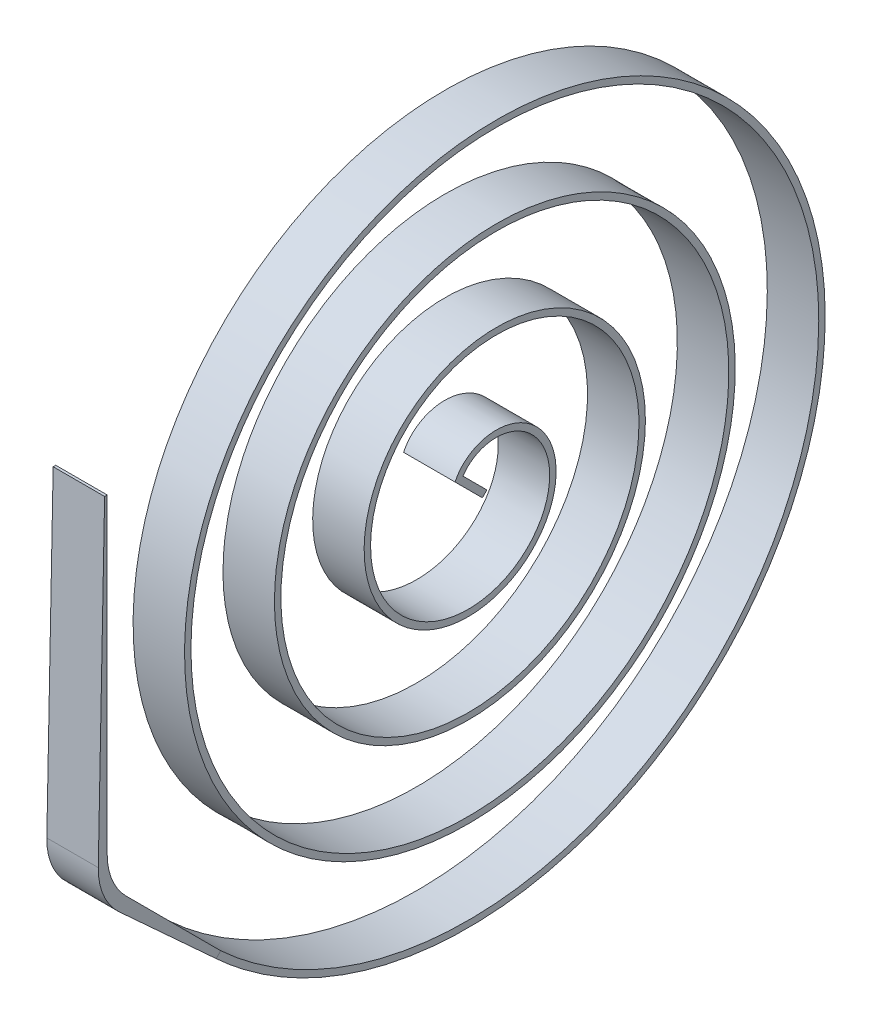
from build123d import *

# Parameters (mm, degrees)
EXTRUDE_1_DEPTH     = 4
CUT_EXTRUDE_3_DEPTH = 4
EXTRUDE_2_DEPTH     = 4
EXTRUDE_3_DEPTH     = 4
FILLET_1_R          = 5


# Read off the part's stored shape, not the designer's step: 拉伸-薄壁1
with BuildPart() as part:
    # 拉伸-薄壁1 outline → 拉伸-薄壁1 (new body)
    with BuildSketch(Plane(origin=(0, 0, 0), x_dir=(0, 0, -1), z_dir=(1, 0, 0))):
        with BuildLine():
            Line((0.353553391, 0.353553391), (-1.503648468, 2.210755249))
            add(Edge.make_bspline(
                [(-1.503648468, 2.210755249), (-1.308098184, 2.515457282), (-1.031402176, 2.800209118), (-0.328960064, 3.251074047), (0.093348021, 3.416104406), (1.028521806, 3.556280116), (1.537893991, 3.531997306), (2.557201106, 3.252783079), (3.064291, 2.999904179), (3.973331649, 2.265948866), (4.3736449, 1.78796665), (4.968150132, 0.654331864), (5.162234178, 0.002190375), (5.269337908, -1.385645211), (5.183809562, -2.118110209), (4.700879937, -3.542487003), (4.306223926, -4.232098419), (3.229498206, -5.437416781), (2.550950629, -5.952227855), (0.987695292, -6.689789787), (0.10661298, -6.913264176), (-1.732750598, -6.988989256), (-2.688010948, -6.843492742), (-4.517860059, -6.159766195), (-5.390643168, -5.624933843), (-6.894524558, -4.20837832), (-7.525429726, -3.330584156), (-8.409947858, -1.339602577), (-8.665084385, -0.230141492), (-8.714241785, 2.060643361), (-8.511286323, 3.239164327), (-7.631553511, 5.476475434), (-6.958793489, 6.533959404), (-5.206225045, 8.340344427), (-4.130716409, 9.089750306), (-1.714062255, 10.126570298), (-0.376708147, 10.416289415), (2.365690797, 10.444798439), (3.768179747, 10.187348934), (6.415486985, 9.117140593), (7.659512606, 8.308971908), (9.77296892, 6.224609053), (10.643595166, 4.95303249), (11.838660304, 2.112884571), (12.166154256, 0.548120606), (12.180434414, -2.646162399), (11.871664619, -4.273406452), (10.616881722, -7.333450331), (9.675963351, -8.765979862), (7.264258556, -11.191346802), (5.798336458, -12.186048016), (2.536982574, -13.545587787), (0.74531457, -13.914177117), (-2.901116915, -13.920912023), (-4.753920264, -13.564104867), (-8.229513185, -12.130867005), (-9.852552284, -11.0599419), (-12.59479217, -8.325508549), (-13.715955477, -6.666709919), (-15.24808083, -2.987011929), (-15.659320782, -0.968747991), (-15.667155005, 3.13031639), (-15.263864334, 5.208942783), (-14.060973281, 8.130146392), (-13.561650638, 9.070939818), (-12.37974169, 10.848237384), (-11.697591423, 11.684641224), (-10.171912436, 13.217474321), (-9.328834721, 13.913901754), (-7.510138999, 15.135705335), (-6.534964906, 15.661179757), (-4.48689411, 16.515963213), (-3.414412198, 16.845467335), (-1.211286336, 17.290306612), (-0.081007129, 17.405925566), (2.194866022, 17.412992271), (3.340164037, 17.304799944), (5.601562911, 16.862835185), (6.717452311, 16.529482273), (8.875584174, 15.644643338), (9.917711376, 15.093616737), (11.885695488, 13.789648494), (12.811540497, 13.037184233), (14.507895282, 11.354893285), (15.278498703, 10.425538795), (16.630493359, 8.421576024), (17.212080811, 7.34741154), (18.158814241, 5.092396621), (18.52425095, 3.911939433), (19.019329016, 1.487988009), (19.149342807, 0.244816501), (19.163038333, -2.257444027), (19.047157211, -3.516297612), (18.567955532, -6.001115467), (18.205116422, -7.226944309), (17.240571879, -9.597107328), (16.639369357, -10.741414054), (15.216224255, -12.902050072), (14.394781864, -13.918462659), (12.558327882, -15.780827824), (11.543789407, -16.626971806), (9.356481346, -18.112075882), (8.184134493, -18.751327512), (5.723496288, -19.793248764), (4.435556178, -20.196297069), (1.791448098, -20.745048835), (0.435542051, -20.891200712), (-2.293115181, -20.91502694), (-3.665707384, -20.793198414), (-6.374632348, -20.280195855), (-7.710917765, -19.889544016), (-10.294453646, -18.848533597), (-11.541771691, -18.198697179), (-13.897004826, -16.659295467), (-15.005100069, -15.770226975), (-17.035951273, -13.782099539), (-17.958992028, -12.683487742), (-19.580118348, -10.314798343), (-20.278580181, -9.045096197), (-21.418929266, -6.380197921), (-21.861266459, -4.985286908), (-22.467136598, -2.121732261), (-22.631171578, -0.653269114), (-22.668647421, 2.301755507), (-22.542618103, 3.788250303), (-21.999274449, 6.721935674), (-21.58249188, 8.16917693), (-20.468284973, 10.967397527), (-19.771368281, 12.318542601), (-18.118664785, 14.870294189), (-17.163336528, 16.071173393), (-15.026063548, 18.272969208), (-13.844505672, 19.274251944), (-11.296439664, 21.034303624), (-9.930227629, 21.793513832), (-7.062474325, 23.035528763), (-5.56112391, 23.518827715), (-2.47887423, 24.185266692), (-0.898051423, 24.368928974), (2.283271655, 24.423586735), (3.883813153, 24.295106072), (7.042875828, 23.724901631), (8.60155313, 23.283676758), (11.615738385, 22.099569702), (13.071508594, 21.357136182), (15.821673677, 19.594118159), (17.116422603, 18.573909389), (19.491601863, 16.290055549), (20.572458854, 15.026694424), (22.474326535, 12.301296354), (23.295813419, 10.839437575), (24.642727453, 7.770275734), (25.168654592, 6.163036725), (25.899116013, 2.862885134), (26.104147024, 1.169920324), (26.179529941, -2.237592036), (26.050348406, -3.952303921), (25.456781832, -7.337323347), (24.992807885, -9.00789697), (23.742122123, -12.239293529), (22.955743664, -13.800468242), (21.085429334, -16.750913934), (20.001731113, -18.140601461), (17.573896798, -20.69158146), (16.229890037, -21.853330555), (13.329243599, -23.899890516), (11.772618481, -24.785170938), (8.503535756, -26.240210682), (6.790978099, -26.810424401), (3.273759401, -27.608363185), (1.468890595, -27.836500028), (-2.164661204, -27.936160578), (-3.993646307, -27.808028204), (-7.605163775, -27.194614983), (-9.388073378, -26.709588679), (-12.837893648, -25.395669467), (-14.505232591, -24.566925269), (-17.657796947, -22.592362779), (-19.143473991, -21.446577062), (-21.872649226, -18.877397596), (-23.116592644, -17.453916924), (-25.310705479, -14.380144472), (-26.261283574, -12.729650258), (-27.827667652, -9.26217526), (-28.443816994, -7.444887878), (-29.312688083, -3.711478607), (-29.565662243, -1.794964262), (-29.693160936, 2.064436179), (-29.567826088, 4.007776138), (-28.938097461, 7.846294285), (-28.433717884, 9.741958355), (-27.059933373, 13.41137983), (-26.190408974, 15.185622338), (-24.11467565, 18.542113552), (-22.908216099, 20.124810442), (-21.554287042, 21.579682802)],
                knots=[0, 0, 0, 0, 0.015625, 0.015625, 0.03125, 0.03125, 0.046875, 0.046875, 0.0625, 0.0625, 0.078125, 0.078125, 0.09375, 0.09375, 0.109375, 0.109375, 0.125, 0.125, 0.140625, 0.140625, 0.15625, 0.15625, 0.171875, 0.171875, 0.1875, 0.1875, 0.203125, 0.203125, 0.21875, 0.21875, 0.234375, 0.234375, 0.25, 0.25, 0.265625, 0.265625, 0.28125, 0.28125, 0.296875, 0.296875, 0.3125, 0.3125, 0.328125, 0.328125, 0.34375, 0.34375, 0.359375, 0.359375, 0.375, 0.375, 0.390625, 0.390625, 0.40625, 0.40625, 0.421875, 0.421875, 0.4375, 0.4375, 0.453125, 0.453125, 0.46875, 0.46875, 0.484375, 0.484375, 0.4921875, 0.4921875, 0.5, 0.5, 0.5078125, 0.5078125, 0.515625, 0.515625, 0.5234375, 0.5234375, 0.53125, 0.53125, 0.5390625, 0.5390625, 0.546875, 0.546875, 0.5546875, 0.5546875, 0.5625, 0.5625, 0.5703125, 0.5703125, 0.578125, 0.578125, 0.5859375, 0.5859375, 0.59375, 0.59375, 0.6015625, 0.6015625, 0.609375, 0.609375, 0.6171875, 0.6171875, 0.625, 0.625, 0.6328125, 0.6328125, 0.640625, 0.640625, 0.6484375, 0.6484375, 0.65625, 0.65625, 0.6640625, 0.6640625, 0.671875, 0.671875, 0.6796875, 0.6796875, 0.6875, 0.6875, 0.6953125, 0.6953125, 0.703125, 0.703125, 0.7109375, 0.7109375, 0.71875, 0.71875, 0.7265625, 0.7265625, 0.734375, 0.734375, 0.7421875, 0.7421875, 0.75, 0.75, 0.7578125, 0.7578125, 0.765625, 0.765625, 0.7734375, 0.7734375, 0.78125, 0.78125, 0.7890625, 0.7890625, 0.796875, 0.796875, 0.8046875, 0.8046875, 0.8125, 0.8125, 0.8203125, 0.8203125, 0.828125, 0.828125, 0.8359375, 0.8359375, 0.84375, 0.84375, 0.8515625, 0.8515625, 0.859375, 0.859375, 0.8671875, 0.8671875, 0.875, 0.875, 0.8828125, 0.8828125, 0.890625, 0.890625, 0.8984375, 0.8984375, 0.90625, 0.90625, 0.9140625, 0.9140625, 0.921875, 0.921875, 0.9296875, 0.9296875, 0.9375, 0.9375, 0.9453125, 0.9453125, 0.953125, 0.953125, 0.9609375, 0.9609375, 0.96875, 0.96875, 0.9765625, 0.9765625, 0.984375, 0.984375, 0.9921875, 0.9921875, 1, 1, 1, 1], degree=3))
            Line((-21.554287042, 21.579682802), (-21.920310217, 21.920310217))
            add(Edge.make_bspline(
                [(-2.121320344, 2.121320344), (-1.946759899, 2.502120266), (-1.675382244, 2.868908278), (-0.955566353, 3.482763508), (-0.507236314, 3.729166667), (0.507236314, 4.020833333), (1.072979751, 4.065524736), (2.227664853, 3.902936232), (2.815977181, 3.695297762), (3.90153724, 3.022216659), (4.398034458, 2.55671546), (5.187215692, 1.413625151), (5.479166667, 0.736310778), (5.770833333, -0.736310778), (5.76997692, -1.531038548), (5.432062411, -3.108998069), (5.094714737, -3.891433941), (4.097673419, -5.300954215), (3.438048676, -5.927160637), (1.871683948, -6.891667876), (0.965385243, -7.229166667), (-0.965385243, -7.520833333), (-1.989097346, -7.474429105), (-3.990331285, -6.961188591), (-4.966890701, -6.494131711), (-6.700371189, -5.173130179), (-7.456286817, -4.319381891), (-8.59612006, -2.329742746), (-8.979166667, -1.194459707), (-9.270833333, 1.194459707), (-9.178881289, 2.447156144), (-8.49031477, 4.8716645), (-7.893548685, 6.042347461), (-6.248586939, 8.099788163), (-5.200715107, 8.985412997), (-2.787801544, 10.300572245), (-1.423534171, 10.729166667), (1.423534171, 11.020833333), (2.905214941, 10.883333473), (5.752997716, 10.01944095), (7.117804221, 9.292965659), (9.499205137, 7.324043699), (10.514539176, 6.082048323), (12.005024429, 3.245860341), (12.479166667, 1.652608635), (12.770833333, -1.652608635), (12.587785657, -3.363273739), (11.54856713, -6.634330932), (10.692382633, -8.193260981), (8.399500459, -10.898622111), (6.963381538, -12.043665356), (3.703919139, -13.709476613), (1.8816831, -14.229166667), (-1.8816831, -14.520833333), (-3.821332537, -14.292237841), (-7.515664147, -13.077693309), (-9.268717741, -12.091799608), (-12.298039085, -9.474957219), (-13.572791535, -7.844714754), (-14.953644482, -5.082662141), (-15.325999225, -4.109988019), (-15.875232508, -2.09632285), (-16.052083333, -1.055378782), (-16.197916667, 1.055378782), (-16.166881158, 2.125140086), (-15.892537695, 4.251874815), (-15.649222391, 5.308792841), (-14.954287123, 7.367595856), (-14.502671029, 8.369424421), (-13.403527834, 10.276901525), (-12.756015931, 11.18249489), (-11.285614629, 12.85913567), (-10.4627514, 13.630131435), (-8.6696985, 15.003603338), (-7.699545161, 15.606033532), (-5.646539543, 16.614265165), (-4.563732514, 17.02002836), (-2.325394482, 17.613951854), (-1.169916014, 17.802083333), (1.169916014, 17.947916667), (2.354211718, 17.905600504), (4.70561931, 17.586566831), (5.872670243, 17.309843074), (8.143110467, 16.527244804), (9.246438101, 16.021376327), (11.34438366, 14.794966179), (12.338941704, 14.074442852), (14.177562591, 12.442061443), (15.02156978, 11.530233535), (16.522308637, 9.54671218), (17.178991212, 8.475059772), (18.274885848, 6.210416945), (18.714057495, 5.017477009), (19.3526712, 2.554466114), (19.552083333, 1.284453246), (19.697916667, -1.284453246), (19.64431985, -2.58328335), (19.280595966, -5.159363805), (18.970463757, -6.436547646), (18.100202485, -8.918625078), (17.540081625, -10.123451781), (16.186404524, -12.411865796), (15.392869772, -13.495388517), (13.598508256, -15.495989511), (12.597715671, -16.413008125), (10.42372586, -18.041013935), (9.250574383, -18.751948893), (6.774294347, -19.935506531), (5.471221504, -20.40808663), (2.783537746, -21.091390547), (1.398990479, -21.302083333), (-1.398990479, -21.447916667), (-2.812354982, -21.383039196), (-5.6131083, -20.974625101), (-7.000425048, -20.63108444), (-9.694139689, -19.673160165), (-11.00046546, -19.058786923), (-13.479347932, -17.577842869), (-14.651835331, -16.711296693), (-16.814416432, -14.75495507), (-17.80444647, -13.665197807), (-19.559719233, -11.300739539), (-20.324906574, -10.026088994), (-21.596127214, -7.338171749), (-22.102115766, -5.924965999), (-22.830109893, -3.012609378), (-23.052083333, -1.513527711), (-23.197916667, 1.513527711), (-23.121758543, 3.041426615), (-22.668654236, 6.066852795), (-22.291705123, 7.56430245), (-21.246117846, 10.4696543), (-20.577492222, 11.87747914), (-18.969281213, 14.546830068), (-18.029723614, 15.808282144), (-15.911401883, 18.132843352), (-14.732679943, 19.195884814), (-12.177753219, 21.078424531), (-10.801603605, 21.897864255), (-7.902049152, 23.256747897), (-6.378710494, 23.796144901), (-3.241681011, 24.568829239), (-1.628064943, 24.802083333), (1.628064943, 24.947916667), (3.270498247, 24.860477889), (6.52059729, 24.362683371), (8.128179852, 23.952325807), (11.245168911, 22.819075527), (12.75449282, 22.09619752), (15.614312204, 20.360719558), (16.964728958, 19.348150534), (19.451270273, 17.067848697), (20.587323159, 15.800162079), (22.59712983, 13.054766899), (23.470821935, 11.577118216), (24.91736858, 8.465926554), (25.490174036, 6.832454989), (26.307548585, 3.470752643), (26.552083333, 1.742602175), (26.697916667, -1.742602175), (26.599197235, -3.499569879), (26.056712507, -6.974341784), (25.61294649, -8.692057254), (24.392033208, -12.020683523), (23.614902818, -13.6315065), (21.752157903, -16.681794339), (20.666577455, -18.121175772), (18.22429551, -20.769697194), (16.867644214, -21.978761504), (13.931780579, -24.115835128), (12.352632828, -25.043779616), (9.029803956, -26.577989263), (7.286199484, -27.184203171), (3.699824275, -28.046267932), (1.857139407, -28.302083333), (-1.857139407, -28.447916667), (-3.728641511, -28.337916581), (-7.428086279, -27.750741642), (-9.255934656, -27.273567173), (-12.796198134, -25.964990888), (-14.508520179, -25.133608117), (-17.749276475, -23.143596248), (-19.277622585, -21.985004375), (-22.088124114, -19.380742324), (-23.370199849, -17.93512635), (-25.634540426, -14.808794258), (-26.616737297, -13.128147439), (-28.238609946, -9.593681358), (-28.878232306, -7.739943978), (-29.784987278, -3.928895907), (-30.052083333, -1.971676639), (-30.197916667, 1.971676639), (-30.076635928, 3.957713143), (-29.444770777, 7.881830774), (-28.934187856, 9.819812058), (-27.537948569, 13.571712745), (-26.652313415, 15.385533859), (-24.535034592, 18.816758611), (-23.303431296, 20.434069399), (-21.920310217, 21.920310217)],
                knots=[0, 0, 0, 0, 0.015625, 0.015625, 0.03125, 0.03125, 0.046875, 0.046875, 0.0625, 0.0625, 0.078125, 0.078125, 0.09375, 0.09375, 0.109375, 0.109375, 0.125, 0.125, 0.140625, 0.140625, 0.15625, 0.15625, 0.171875, 0.171875, 0.1875, 0.1875, 0.203125, 0.203125, 0.21875, 0.21875, 0.234375, 0.234375, 0.25, 0.25, 0.265625, 0.265625, 0.28125, 0.28125, 0.296875, 0.296875, 0.3125, 0.3125, 0.328125, 0.328125, 0.34375, 0.34375, 0.359375, 0.359375, 0.375, 0.375, 0.390625, 0.390625, 0.40625, 0.40625, 0.421875, 0.421875, 0.4375, 0.4375, 0.453125, 0.453125, 0.4609375, 0.4609375, 0.46875, 0.46875, 0.4765625, 0.4765625, 0.484375, 0.484375, 0.4921875, 0.4921875, 0.5, 0.5, 0.5078125, 0.5078125, 0.515625, 0.515625, 0.5234375, 0.5234375, 0.53125, 0.53125, 0.5390625, 0.5390625, 0.546875, 0.546875, 0.5546875, 0.5546875, 0.5625, 0.5625, 0.5703125, 0.5703125, 0.578125, 0.578125, 0.5859375, 0.5859375, 0.59375, 0.59375, 0.6015625, 0.6015625, 0.609375, 0.609375, 0.6171875, 0.6171875, 0.625, 0.625, 0.6328125, 0.6328125, 0.640625, 0.640625, 0.6484375, 0.6484375, 0.65625, 0.65625, 0.6640625, 0.6640625, 0.671875, 0.671875, 0.6796875, 0.6796875, 0.6875, 0.6875, 0.6953125, 0.6953125, 0.703125, 0.703125, 0.7109375, 0.7109375, 0.71875, 0.71875, 0.7265625, 0.7265625, 0.734375, 0.734375, 0.7421875, 0.7421875, 0.75, 0.75, 0.7578125, 0.7578125, 0.765625, 0.765625, 0.7734375, 0.7734375, 0.78125, 0.78125, 0.7890625, 0.7890625, 0.796875, 0.796875, 0.8046875, 0.8046875, 0.8125, 0.8125, 0.8203125, 0.8203125, 0.828125, 0.828125, 0.8359375, 0.8359375, 0.84375, 0.84375, 0.8515625, 0.8515625, 0.859375, 0.859375, 0.8671875, 0.8671875, 0.875, 0.875, 0.8828125, 0.8828125, 0.890625, 0.890625, 0.8984375, 0.8984375, 0.90625, 0.90625, 0.9140625, 0.9140625, 0.921875, 0.921875, 0.9296875, 0.9296875, 0.9375, 0.9375, 0.9453125, 0.9453125, 0.953125, 0.953125, 0.9609375, 0.9609375, 0.96875, 0.96875, 0.9765625, 0.9765625, 0.984375, 0.984375, 0.9921875, 0.9921875, 1, 1, 1, 1], degree=3))
            Line((-2.121320344, 2.121320344), (0, 0))
            Line((0, 0), (0.353553391, 0.353553391))
        make_face()
    extrude(amount=EXTRUDE_1_DEPTH)

    # 草图9 → 切除-拉伸3 (cut)
    with BuildSketch(Plane.ZY):
        Polygon((20.337502846, -20.32124106), (20.761059543, -20.744459083), (33.003371405, -8.492350485), (30.770717628, 20.6448695), (22.273628879, 24.965423101), (18.998520019, 21.687693381), (26.880518843, 1.850461334), align=None)
    extrude(amount=-CUT_EXTRUDE_3_DEPTH, mode=Mode.SUBTRACT)


with BuildPart() as body_2:
    # 草图11 → 凸台-拉伸2 (new body)
    with BuildSketch(Plane.ZY):
        Polygon((20.337502797, -20.321241105), (29.164475421, -11.487202476), (29.90219689, -12.22433387), (20.691459172, -20.674914364), align=None)
    extrude(amount=-EXTRUDE_2_DEPTH)

    # 草图12 → 凸台-拉伸3 (add)
    with BuildSketch(Plane.ZY):
        Polygon((29.164475421, -11.487202476), (29.164475421, 14.77566613), (29.364475421, 14.77566613), (29.90219689, -12.22433387), align=None)
    extrude(amount=-EXTRUDE_3_DEPTH)

    # 圆角1
    fillet_1_edges = [body_2.edges().sort_by_distance(p)[0] for p in [
        (2, -11.487202476, 29.164475421),
        (2, -12.22433387, 29.90219689),
    ]]
    fillet(fillet_1_edges, radius=FILLET_1_R)


solid = Compound([part.part, body_2.part])
